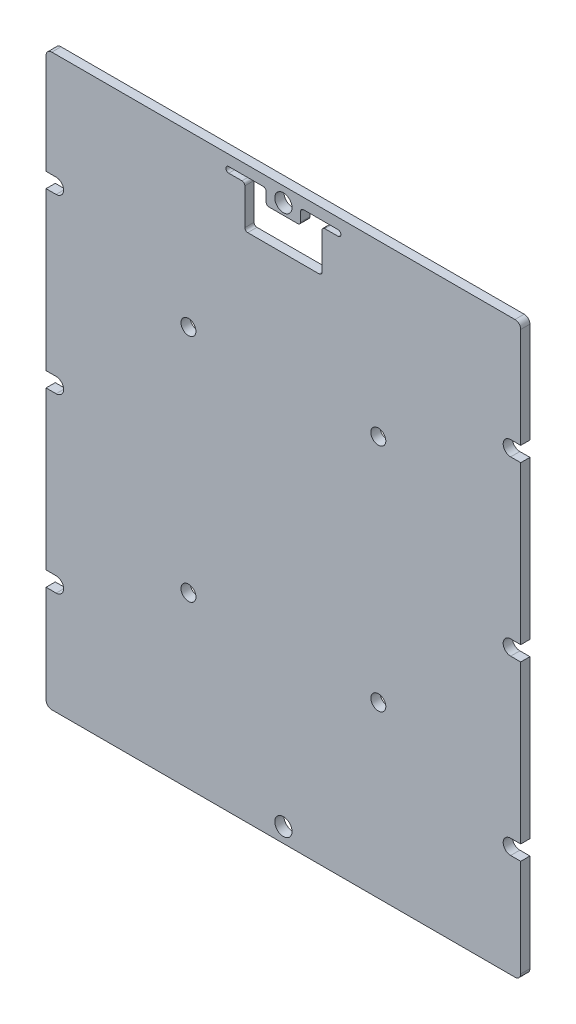
from build123d import *

# Parameters (mm, degrees)
SKETCH2_W            = 82.5
SKETCH2_H            = 99
SKETCH2_R            = 0.8
SKETCH2_R_2          = 1.5
PCB_EXTRUDE_DEPTH    = 0.8
CORNER_FILLETS_R     = 1
SKETCH4_R            = 1.5
SOLAR_HOLES_DEPTH    = 65.454421881
SOLAR_HOLE_FILLETS_R = 0.5
M2_CLEARANCE_HOLES_D = 2.6
SKETCH10_W           = 1.75
SKETCH10_H           = 2.6
CUT_EXTRUDE2_DEPTH   = 65.454421881


with BuildPart() as part:
    # Sketch2 → pcb extrude (new, symmetric)
    with BuildSketch(Plane.XY):
        Rectangle(SKETCH2_W, SKETCH2_H)
        with Locations((-39.5, -30.25)):
            Circle(SKETCH2_R, mode=Mode.SUBTRACT)
        with Locations((-39.5, -0.25)):
            Circle(SKETCH2_R, mode=Mode.SUBTRACT)
        with Locations((-16.5, -20)):
            Circle(SKETCH2_R, mode=Mode.SUBTRACT)
        with Locations((0, -46.95)):
            Circle(SKETCH2_R_2, mode=Mode.SUBTRACT)
        with Locations((39.5, -30.25)):
            Circle(SKETCH2_R, mode=Mode.SUBTRACT)
        with Locations((16.5, -20)):
            Circle(SKETCH2_R, mode=Mode.SUBTRACT)
        with Locations((39.5, -0.25)):
            Circle(SKETCH2_R, mode=Mode.SUBTRACT)
        with Locations((-16.5, 20)):
            Circle(SKETCH2_R, mode=Mode.SUBTRACT)
        with Locations((-39.5, 29.75)):
            Circle(SKETCH2_R, mode=Mode.SUBTRACT)
        with Locations((16.5, 20)):
            Circle(SKETCH2_R, mode=Mode.SUBTRACT)
        with Locations((0, 46.95)):
            Circle(SKETCH2_R, mode=Mode.SUBTRACT)
        with Locations((39.5, 29.75)):
            Circle(SKETCH2_R, mode=Mode.SUBTRACT)
    extrude(amount=PCB_EXTRUDE_DEPTH, both=True)

    # corner fillets
    corner_fillets_edges = [part.edges().sort_by_distance(p)[0] for p in [
        (41.25, -49.5, 0),
        (-41.25, -49.5, 0),
        (41.25, 49.5, 0),
        (-41.25, 49.5, 0),
    ]]
    fillet(corner_fillets_edges, radius=CORNER_FILLETS_R)

    # Sketch4 → solar holes (cut, through all)
    with BuildSketch(Plane.XY.offset(0.8)):
        with Locations((0, 46.95)):
            Circle(SKETCH4_R)
        with BuildLine():
            Line((6.7, 39.35), (-6.7, 39.35))
            Line((-6.7, 39.35), (-6.7, 46.65))
            Line((-6.7, 46.65), (-9.5, 46.65))
            ThreePointArc((-9.5, 46.65), (-10, 47.15), (-9.5, 47.65))
            Line((-9.5, 47.65), (-3, 47.65))
            Line((-3, 47.65), (-3, 45.05))
            Line((-3, 45.05), (3, 45.05))
            Line((3, 45.05), (3, 47.65))
            Line((3, 47.65), (9.5, 47.65))
            ThreePointArc((9.5, 47.65), (10, 47.15), (9.5, 46.65))
            Line((9.5, 46.65), (6.7, 46.65))
            Line((6.7, 46.65), (6.7, 39.35))
        make_face()
    extrude(amount=-SOLAR_HOLES_DEPTH, mode=Mode.SUBTRACT)

    # solar hole fillets
    solar_hole_fillets_edges = [part.edges().sort_by_distance(p)[0] for p in [
        (6.7, 46.65, 0),
        (3, 47.65, 0),
        (3, 45.05, 0),
        (6.7, 39.35, 0),
        (-6.7, 39.35, 0),
        (-6.7, 46.65, 0),
        (-3, 45.05, 0),
        (-3, 47.65, 0),
    ]]
    fillet(solar_hole_fillets_edges, radius=SOLAR_HOLE_FILLETS_R)

    # M2 Clearance Holes (through all)
    with Locations(Plane.XY.offset(0.8)):
        with Locations((-39.5, 29.75), (-39.5, -0.25), (-16.5, 20), (16.5, 20), (16.5, -20), (-16.5, -20), (39.5, 29.75), (39.5, -0.25), (39.5, -30.25), (-39.5, -30.25)):
            Hole(M2_CLEARANCE_HOLES_D / 2)

    # Sketch10 → Cut-Extrude2 (cut, through all)
    with BuildSketch(Plane.XY.offset(0.8)):
        with Locations((-40.375, 29.75)):
            Rectangle(SKETCH10_W, SKETCH10_H)
        with Locations((-40.375, -0.25)):
            Rectangle(SKETCH10_W, SKETCH10_H)
        with Locations((-40.375, -30.25)):
            Rectangle(SKETCH10_W, SKETCH10_H)
        with Locations((40.375, -30.25)):
            Rectangle(SKETCH10_W, SKETCH10_H)
        with Locations((40.375, -0.25)):
            Rectangle(SKETCH10_W, SKETCH10_H)
        with Locations((40.375, 29.75)):
            Rectangle(SKETCH10_W, SKETCH10_H)
    extrude(amount=-CUT_EXTRUDE2_DEPTH, mode=Mode.SUBTRACT)


solid = part.part
